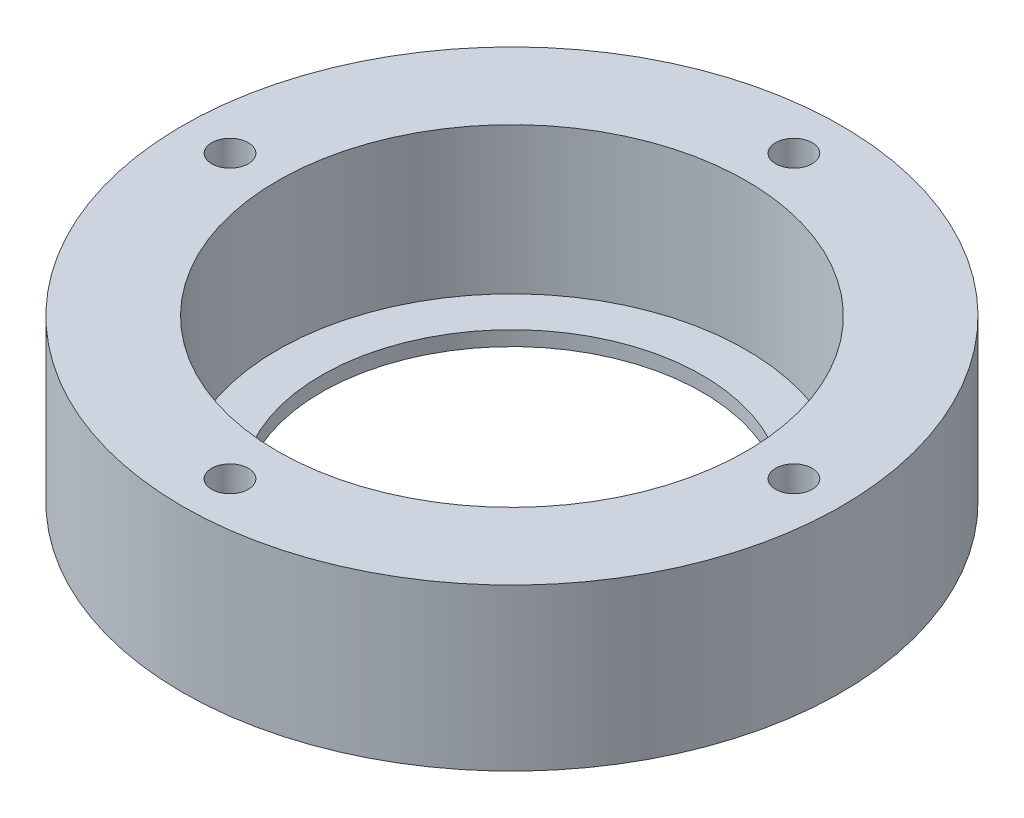
from build123d import *

# Parameters (mm, degrees)
SKETCH_1_R          = 22.5
EXTRUDE_1_DEPTH     = 11
SKETCH_2_R          = 16
CUT_EXTRUDE_1_DEPTH = 10
SKETCH_3_R          = 13
CUT_EXTRUDE_2_DEPTH = 34.35416016
M3X0_51_D           = 2.5
M3X0_51_DEPTH       = 8.5
M3X0_51_TIP         = 0.751075774


with BuildPart() as part:
    # Эскиз1 → Бобышка-Вытянуть1 (new body)
    with BuildSketch(Plane(origin=(0, 0, 0), x_dir=(1, 0, 0), z_dir=(0, 1, 0))):
        Circle(SKETCH_1_R)
    extrude(amount=EXTRUDE_1_DEPTH)

    # Эскиз2 → Вырез-Вытянуть1 (cut)
    with BuildSketch(Plane(origin=(0, 11, 0), x_dir=(1, 0, 0), z_dir=(0, 1, 0))):
        Circle(SKETCH_2_R)
    extrude(amount=-CUT_EXTRUDE_1_DEPTH, mode=Mode.SUBTRACT)

    # Эскиз3 → Вырез-Вытянуть2 (cut, through all)
    with BuildSketch(Plane(origin=(0, 1, 0), x_dir=(1, 0, 0), z_dir=(0, 1, 0))):
        Circle(SKETCH_3_R)
    extrude(amount=-CUT_EXTRUDE_2_DEPTH, mode=Mode.SUBTRACT)

    # Отверстие обработанное метчиком M3x0.51
    with Locations(Plane(origin=(0, 11, 0), x_dir=(1, 0, 0), z_dir=(0, 1, 0))):
        with Locations((-19.25, 0), (0, -19.25), (19.25, 0), (0, 19.25)):
            Hole(M3X0_51_D / 2, depth=M3X0_51_DEPTH)
            with Locations((0, 0, -(M3X0_51_DEPTH + M3X0_51_TIP / 2))):  # 118° drill point
                Cone(0, M3X0_51_D / 2, M3X0_51_TIP, mode=Mode.SUBTRACT)


solid = part.part
